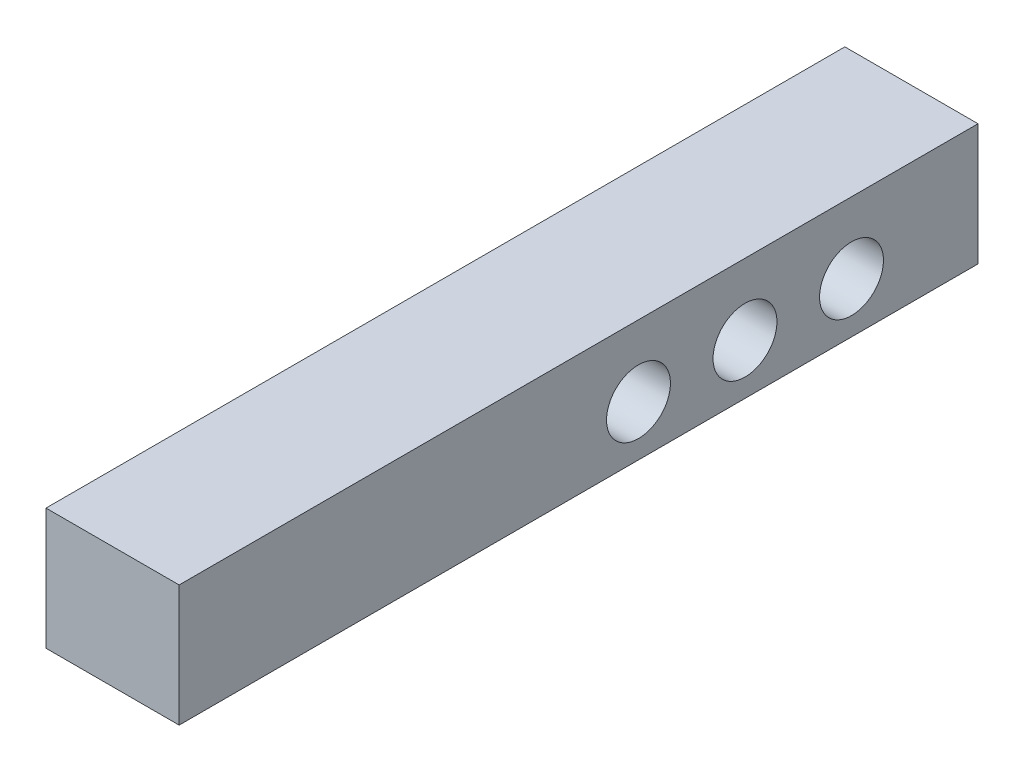
from build123d import *

# Parameters (mm, degrees)
CROQUIS1_W              = 10
CROQUIS1_H              = 60
SALIENTE_EXTRUIR1_DEPTH = 9.12
CROQUIS2_R              = 2.4
CORTAR_EXTRUIR1_DEPTH   = 62.507514988


with BuildPart() as part:
    # Croquis1 → Saliente-Extruir1 (new body)
    with BuildSketch(Plane(origin=(0, 0, 0), x_dir=(1, 0, 0), z_dir=(0, 1, 0))):
        with Locations((-5, -30)):
            Rectangle(CROQUIS1_W, CROQUIS1_H)
    extrude(amount=SALIENTE_EXTRUIR1_DEPTH)

    # Croquis2 → Cortar-Extruir1 (cut, through all)
    with BuildSketch(Plane.ZY.offset(10)):
        with Locations((17.5, 3.79)):
            Circle(CROQUIS2_R)
        with Locations((9.5, 3.79)):
            Circle(CROQUIS2_R)
        with Locations((25.5, 3.79)):
            Circle(CROQUIS2_R)
    extrude(amount=-CORTAR_EXTRUIR1_DEPTH, mode=Mode.SUBTRACT)


solid = part.part
